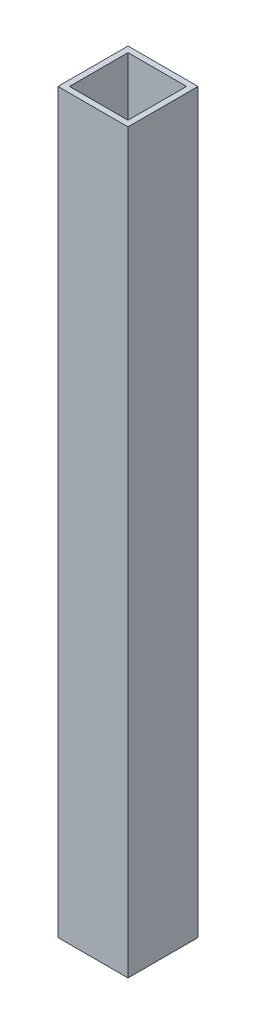
from build123d import *

# Parameters (mm, degrees)
SKETCH1_W           = 19.304
SKETCH1_H           = 19.304
SKETCH1_W_2         = 16.129
SKETCH1_H_2         = 16.129
BOSS_EXTRUDE1_DEPTH = 101.6


with BuildPart() as part:
    # Sketch1 → Boss-Extrude1 (new, symmetric)
    with BuildSketch(Plane(origin=(0, 0, 0), x_dir=(1, 0, 0), z_dir=(0, 1, 0))):
        Rectangle(SKETCH1_W, SKETCH1_H)
        Rectangle(SKETCH1_W_2, SKETCH1_H_2, mode=Mode.SUBTRACT)
    extrude(amount=BOSS_EXTRUDE1_DEPTH, both=True)


solid = part.part
